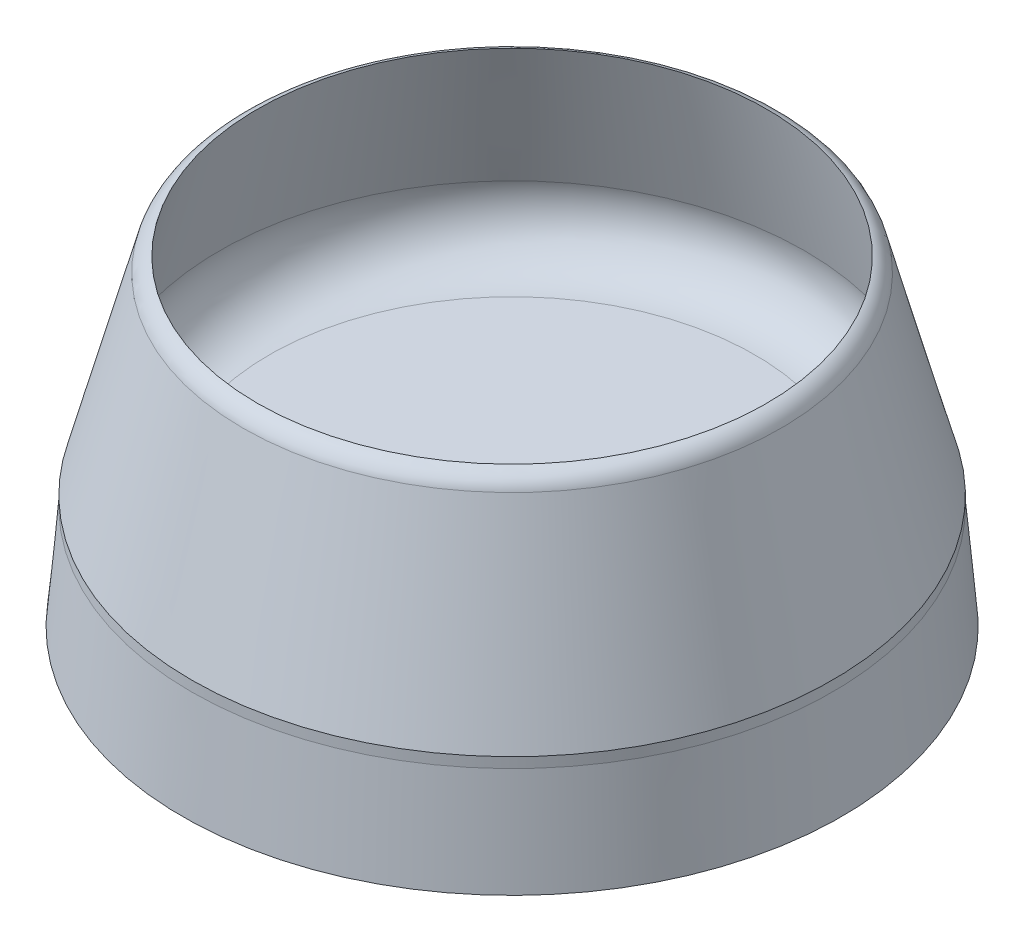
from build123d import *

# Parameters (mm, degrees)
SKETCH1_R           = 39.37
BOSS_EXTRUDE1_DEPTH = 0.635
SKETCH4_R           = 39.37
BOSS_EXTRUDE2_DEPTH = 25.4
BOSS_EXTRUDE2_TAPER = 15
SKETCH5_R           = 31.2940954
CUT_EXTRUDE2_DEPTH  = 25.4
CUT_EXTRUDE2_DRAFT  = 15
SKETCH6_R           = 39.37
BOSS_EXTRUDE3_DEPTH = 12.7
BOSS_EXTRUDE3_DRAFT = -5
SKETCH8_R           = 39.211105982
CUT_EXTRUDE3_DEPTH  = 12.7
CUT_EXTRUDE3_DRAFT  = -5
SKETCH9_R           = 1.5875
BOSS_EXTRUDE4_DEPTH = 19.05
SKETCH12_R          = 1.5875
REVOLVE1_ANGLE      = 180
FILLET1_R           = 6.35
FILLET3_R           = 2.54
FILLET4_R           = 6.35
FILLET5_R           = 2.54


with BuildPart() as part:
    # Sketch1 → Boss-Extrude1 (new, symmetric)
    with BuildSketch(Plane(origin=(0, 0, 0), x_dir=(1, 0, 0), z_dir=(0, 1, 0))):
        with Locations(Location((0, 0, 0), (0, 0, 270))):
            Circle(SKETCH1_R)
    extrude(amount=BOSS_EXTRUDE1_DEPTH, both=True)

    # Sketch4 → Boss-Extrude2 (add)
    with BuildSketch(Plane(origin=(0, 0.635, 0), x_dir=(1, 0, 0), z_dir=(0, 1, 0))):
        with Locations(Location((0, 0, 0), (0, 0, 270))):
            Circle(SKETCH4_R)
    extrude(amount=BOSS_EXTRUDE2_DEPTH, taper=BOSS_EXTRUDE2_TAPER)


with BuildPart() as cut_extrude2_tool:
    # Sketch5 → Cut-Extrude2 (with draft: the straight prism first)
    with BuildSketch(Plane(origin=(0, 26.035, 0), x_dir=(1, 0, 0), z_dir=(0, 1, 0))):
        Circle(SKETCH5_R)
    extrude(amount=-CUT_EXTRUDE2_DEPTH)
    # Cut-Extrude2: the draft: its side faces are tilted about the plane it starts from
    cut_extrude2_sides = [cut_extrude2_tool.faces().sort_by_distance(p)[0] for p in [
        (-31.2940954, 13.335, 0),
    ]]
    draft(cut_extrude2_sides, Plane(origin=(0, 26.035, 0), x_dir=(1, 0, 0), z_dir=(0, 1, 0)), CUT_EXTRUDE2_DRAFT)


with BuildPart() as part_1:
    add(part.part)

    # Cut-Extrude2: cut by cut_extrude2_tool
    add(cut_extrude2_tool.part, mode=Mode.SUBTRACT)


with BuildPart() as boss_extrude3_tool:
    # Sketch6 → Boss-Extrude3 (with draft: the straight prism first)
    with BuildSketch(Plane.XZ.offset(0.635)):
        with Locations(Location((0, 0, 0), (0, 0, 270))):
            Circle(SKETCH6_R)
    extrude(amount=BOSS_EXTRUDE3_DEPTH)
    # Boss-Extrude3: the draft: its side faces are tilted about the plane it starts from
    boss_extrude3_sides = [boss_extrude3_tool.faces().sort_by_distance(p)[0] for p in [
        (0, -6.985, 39.37),
    ]]
    draft(boss_extrude3_sides, Plane.XZ.offset(0.635), BOSS_EXTRUDE3_DRAFT)


with BuildPart() as part_2:
    add(part_1.part)

    # Boss-Extrude3: add boss_extrude3_tool
    add(boss_extrude3_tool.part)


with BuildPart() as cut_extrude3_tool:
    # Sketch8 → Cut-Extrude3 (with draft: the straight prism first)
    with BuildSketch(Plane.XZ.offset(13.335)):
        Circle(SKETCH8_R)
    extrude(amount=-CUT_EXTRUDE3_DEPTH)
    # Cut-Extrude3: the draft: its side faces are tilted about the plane it starts from
    cut_extrude3_sides = [cut_extrude3_tool.faces().sort_by_distance(p)[0] for p in [
        (-39.211105982, -6.985, 0),
    ]]
    draft(cut_extrude3_sides, Plane.XZ.offset(13.335), CUT_EXTRUDE3_DRAFT)


with BuildPart() as part_3:
    add(part_2.part)

    # Cut-Extrude3: cut by cut_extrude3_tool
    add(cut_extrude3_tool.part, mode=Mode.SUBTRACT)

    # Sketch9 → Boss-Extrude4 (add)
    with BuildSketch(Plane.XZ.offset(0.635)):
        with Locations(Location((0, 9.525, 0), (0, 0, 90))):
            Circle(SKETCH9_R)
        with Locations(Location((0, -9.525, 0), (0, 0, 90))):
            Circle(SKETCH9_R)
    extrude(amount=BOSS_EXTRUDE4_DEPTH)

    # Sketch12 → Revolve1 (revolve)
    with BuildSketch(Plane(origin=(0, -19.685, 0), x_dir=(-1, 0, 0), z_dir=(0, -1, 0))):
        with Locations(Location((0, 9.525, 0), (0, 0, 90))):
            Circle(SKETCH12_R)
    revolve(axis=Axis((0, -19.685, 0), (-1, 0, 0)), revolution_arc=REVOLVE1_ANGLE)

    # Fillet1
    fillet1_edges = [part_3.edges().sort_by_distance(p)[0] for p in [
        (-38.100004888, 0.635, 0),
    ]]
    fillet(fillet1_edges, radius=FILLET1_R)

    # Fillet3
    # the kernel refuses this fillet: 2.54 mm, written as the material it takes off along each edge
    with BuildSketch(Plane(origin=(0, 26.035, 0), x_dir=(0, 0, 1), z_dir=(1, 0, 0))) as fillet3_piece_1:
        with BuildLine():
            CenterArc((30.588275028, 2.439962623), FILLET3_R, 286.133838587, 58.866161413)
            Line((33.041726627, 1.782562249), (33.090795659, 1.769414241))
            Line((33.090795659, 1.769414241), (32.613159544, -0.013148007))
            Line((32.613159544, -0.013148007), (32.564090512, -0.0508))
            ThreePointArc((32.564090512, -0.0508), (31.929092956, -0.0508), (31.308211807, -0.048799252))
            Line((31.308211807, -0.048799252), (31.2940954, 0))
        make_face()
    revolve(axis=Axis((0, 26.035, 0), (0, -1, 0)), mode=Mode.SUBTRACT)

    # Fillet4
    fillet4_edges = [part_3.edges().sort_by_distance(p)[0] for p in [
        (-38.099999955, -0.635, 0),
    ]]
    fillet(fillet4_edges, radius=FILLET4_R)

    # Fillet5
    # the kernel refuses this fillet: 2.54 mm, written as the material it takes off along each edge
    with BuildSketch(Plane(origin=(0, -13.335, 0), x_dir=(1, 0, 0), z_dir=(0, 0, -1))) as fillet5_piece_1:
        with BuildLine():
            CenterArc((41.559614506, -2.299656379), FILLET5_R, 115.125957248, 59.874042752)
            Line((40.481106027, 0), (40.459535857, 0.045993128))
            ThreePointArc((40.459535857, 0.045993128), (39.846106004, 0.0508), (39.211105982, 0.0508))
            Line((39.211105982, 0.0508), (39.160499291, 0.004427512))
            Line((39.160499291, 0.004427512), (38.978673282, -2.07385328))
            Line((38.978673282, -2.07385328), (39.029279973, -2.078280792))
        make_face()
    revolve(axis=Axis((0, -13.335, 0), (0, -1, 0)), mode=Mode.SUBTRACT)


solid = part_3.part
